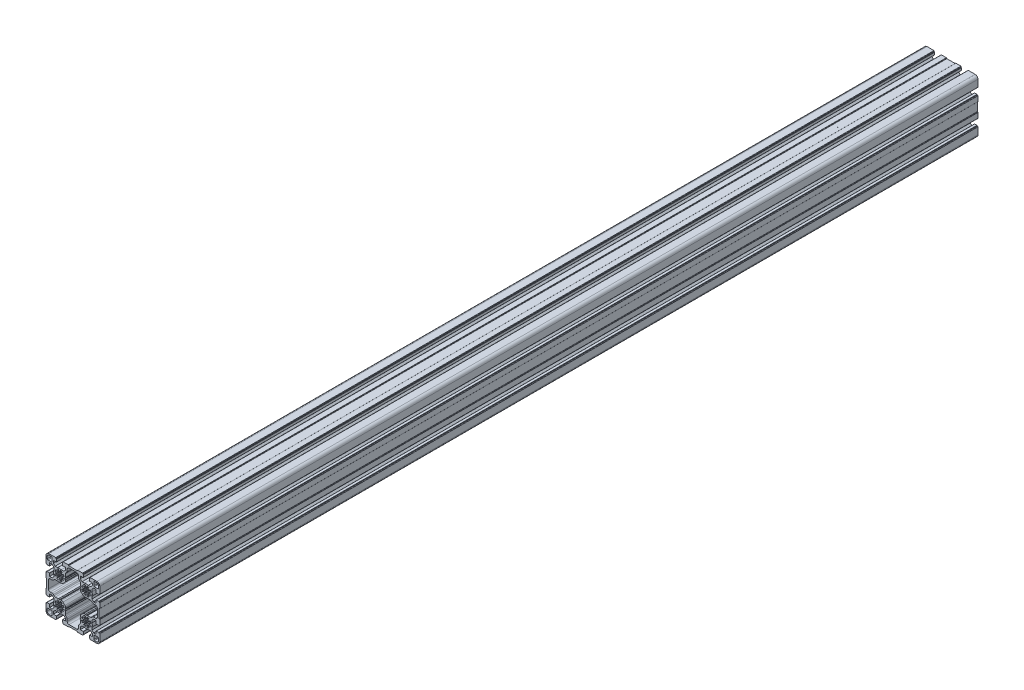
from build123d import *

# Parameters (mm, degrees)
BOSS_EXTRUDE1_DEPTH = 735
SKETCH2_OUTSIDE_W   = 387.1
SKETCH2_OUTSIDE_H   = 387.1
SKETCH2_OUTSIDE_W_2 = 89.98003433
SKETCH2_OUTSIDE_H_2 = 89.980074573
CUT_EXTRUDE1_DEPTH  = 1474.609519808


# Read off the part's stored shape, not the designer's step: Imported1
with BuildPart() as part:
    # Sketch1 → Boss-Extrude1 (new, symmetric)
    with BuildSketch(Plane.XY):
        with BuildLine():
            Line((-36.999936309, 51.000061965), (-36.999936309, 36.999949404))
            ThreePointArc((-36.999936309, 36.999949404), (-37.146382648, 36.646396853), (-37.499935309, 36.499950778))
            ThreePointArc((-37.499935309, 36.499950778), (-37.85348919, 36.353503482), (-37.999934309, 35.999948699))
            Line((-37.999934309, 35.999948699), (-37.999827199, 27.800090876))
            ThreePointArc((-37.999827199, 27.800090876), (-37.853379435, 27.446539596), (-37.499827199, 27.300094141))
            Line((-37.499827199, 27.300094141), (-36.499865902, 27.300094141))
            Line((-36.499865902, 27.300094141), (-36.499865902, 26.800094141))
            ThreePointArc((-36.499865902, 26.800094141), (-36.411997936, 26.587962107), (-36.199865902, 26.500094141))
            Line((-36.199865902, 26.500094141), (-32.299865902, 26.500094141))
            ThreePointArc((-32.299865902, 26.500094141), (-32.087733868, 26.587962107), (-31.999865902, 26.800094141))
            Line((-31.999865902, 26.800094141), (-31.999865902, 31.55021348))
            Line((-31.999865902, 31.55021348), (-27.892690194, 31.55021348))
            Line((-27.892690194, 31.55021348), (-24.999755881, 28.657279167))
            Line((-24.999755881, 28.657279167), (-24.999755881, 24.622983715))
            ThreePointArc((-24.999755881, 24.622983715), (-25.499895222, 21.500060811), (-24.999755881, 18.377137908))
            Line((-24.999755881, 18.377137908), (-24.999755881, 14.342909115))
            Line((-24.999755881, 14.342909115), (-27.892690194, 11.449974802))
            Line((-27.892690194, 11.449974802), (-31.999865902, 11.449974802))
            Line((-31.999865902, 11.449974802), (-31.999865902, 16.200094141))
            ThreePointArc((-31.999865902, 16.200094141), (-32.087733868, 16.412226176), (-32.299865902, 16.500094141))
            Line((-32.299865902, 16.500094141), (-36.199865902, 16.500094141))
            ThreePointArc((-36.199865902, 16.500094141), (-36.411997936, 16.412226176), (-36.499865902, 16.200094141))
            Line((-36.499865902, 16.200094141), (-36.499865902, 15.700094141))
            Line((-36.499865902, 15.700094141), (-37.499974552, 15.700094141))
            ThreePointArc((-37.499974552, 15.700094141), (-37.85352826, 15.553647214), (-37.999974552, 15.200093243))
            Line((-37.999974552, 15.200093243), (-37.999934309, 3.999983871))
            ThreePointArc((-37.999934309, 3.999983871), (-36.535468215, 0.464468094), (-32.999952438, -0.999998))
            Line((-32.999952438, -0.999998), (-21.799856535, -1.000038243))
            ThreePointArc((-21.799856535, -1.000038243), (-21.446302564, -0.853591951), (-21.299855637, -0.500038243))
            Line((-21.299855637, -0.500038243), (-21.299855637, 0.500070407))
            Line((-21.299855637, 0.500070407), (-20.799855637, 0.500070407))
            ThreePointArc((-20.799855637, 0.500070407), (-20.587723602, 0.587938372), (-20.499855637, 0.800070407))
            Line((-20.499855637, 0.800070407), (-20.499855637, 4.700070407))
            ThreePointArc((-20.499855637, 4.700070407), (-20.587723602, 4.912202441), (-20.799855637, 5.000070407))
            Line((-20.799855637, 5.000070407), (-25.549974976, 5.000070407))
            Line((-25.549974976, 5.000070407), (-25.549974976, 9.107246115))
            Line((-25.549974976, 9.107246115), (-22.657040663, 12.000180428))
            Line((-22.657040663, 12.000180428), (-18.62281187, 12.000180428))
            ThreePointArc((-18.62281187, 12.000180428), (-15.499888967, 11.500041087), (-12.376966063, 12.000180428))
            Line((-12.376966063, 12.000180428), (-8.342670611, 12.000180428))
            Line((-8.342670611, 12.000180428), (-5.449736298, 9.107246115))
            Line((-5.449736298, 9.107246115), (-5.449736298, 5.000070407))
            Line((-5.449736298, 5.000070407), (-10.199855637, 5.000070407))
            ThreePointArc((-10.199855637, 5.000070407), (-10.411987671, 4.912202441), (-10.499855637, 4.700070407))
            Line((-10.499855637, 4.700070407), (-10.499855637, 0.800070407))
            ThreePointArc((-10.499855637, 0.800070407), (-10.411987671, 0.587938372), (-10.199855637, 0.500070407))
            Line((-10.199855637, 0.500070407), (-9.699855637, 0.500070407))
            Line((-9.699855637, 0.500070407), (-9.699855637, -0.49989089))
            ThreePointArc((-9.699855637, -0.49989089), (-9.553410182, -0.853443126), (-9.199858902, -0.99989089))
            Line((-9.199858902, -0.99989089), (-1.000001079, -0.999998))
            ThreePointArc((-1.000001079, -0.999998), (-0.646446296, -0.853552881), (-0.499999, -0.499999))
            ThreePointArc((-0.499999, -0.499999), (-0.353552859, -0.146446273), (-1.87e-07, 0))
            Line((-1.87e-07, 0), (14.000112187, 0))
            ThreePointArc((14.000112187, 0), (14.353664859, -0.146446273), (14.500111, -0.499999))
            ThreePointArc((14.500111, -0.499999), (14.646558296, -0.853552881), (15.000113079, -0.999998))
            Line((15.000113079, -0.999998), (23.199970902, -0.99989089))
            ThreePointArc((23.199970902, -0.99989089), (23.553522182, -0.853443126), (23.699967637, -0.49989089))
            Line((23.699967637, -0.49989089), (23.699967637, 0.500070407))
            Line((23.699967637, 0.500070407), (24.199967637, 0.500070407))
            ThreePointArc((24.199967637, 0.500070407), (24.412099671, 0.587938372), (24.499967637, 0.800070407))
            Line((24.499967637, 0.800070407), (24.499967637, 4.700070407))
            ThreePointArc((24.499967637, 4.700070407), (24.412099671, 4.912202441), (24.199967637, 5.000070407))
            Line((24.199967637, 5.000070407), (19.449848298, 5.000070407))
            Line((19.449848298, 5.000070407), (19.449848298, 9.107246115))
            Line((19.449848298, 9.107246115), (22.342782611, 12.000180428))
            Line((22.342782611, 12.000180428), (26.377078063, 12.000180428))
            ThreePointArc((26.377078063, 12.000180428), (29.500000967, 11.500041087), (32.62292387, 12.000180428))
            Line((32.62292387, 12.000180428), (36.657152663, 12.000180428))
            Line((36.657152663, 12.000180428), (39.550086976, 9.107246115))
            Line((39.550086976, 9.107246115), (39.550086976, 5.000070407))
            Line((39.550086976, 5.000070407), (34.799967637, 5.000070407))
            ThreePointArc((34.799967637, 5.000070407), (34.587835602, 4.912202441), (34.499967637, 4.700070407))
            Line((34.499967637, 4.700070407), (34.499967637, 0.800070407))
            ThreePointArc((34.499967637, 0.800070407), (34.587835602, 0.587938372), (34.799967637, 0.500070407))
            Line((34.799967637, 0.500070407), (35.299967637, 0.500070407))
            Line((35.299967637, 0.500070407), (35.299967637, -0.500038243))
            ThreePointArc((35.299967637, -0.500038243), (35.446414564, -0.853591951), (35.799968535, -1.000038243))
            Line((35.799968535, -1.000038243), (47.000077907, -0.999998))
            ThreePointArc((47.000077907, -0.999998), (50.535593684, 0.464468094), (52.000059778, 3.999983871))
            Line((52.000059778, 3.999983871), (52.000100021, 15.200079774))
            ThreePointArc((52.000100021, 15.200079774), (51.85365373, 15.553633745), (51.500100021, 15.700080672))
            Line((51.500100021, 15.700080672), (50.499991371, 15.700080672))
            Line((50.499991371, 15.700080672), (50.499991371, 16.200080672))
            ThreePointArc((50.499991371, 16.200080672), (50.412123406, 16.412212706), (50.199991371, 16.500080672))
            Line((50.199991371, 16.500080672), (46.299991371, 16.500080672))
            ThreePointArc((46.299991371, 16.500080672), (46.087859337, 16.412212706), (45.999991371, 16.200080672))
            Line((45.999991371, 16.200080672), (45.999991371, 11.449961333))
            Line((45.999991371, 11.449961333), (41.892815663, 11.449961333))
            Line((41.892815663, 11.449961333), (38.99988135, 14.342895646))
            Line((38.99988135, 14.342895646), (38.99988135, 18.377124438))
            ThreePointArc((38.99988135, 18.377124438), (39.500020691, 21.500047342), (38.99988135, 24.622970246))
            Line((38.99988135, 24.622970246), (38.99988135, 28.657265698))
            Line((38.99988135, 28.657265698), (41.892815663, 31.550200011))
            Line((41.892815663, 31.550200011), (45.999991371, 31.550200011))
            Line((45.999991371, 31.550200011), (45.999991371, 26.800080672))
            ThreePointArc((45.999991371, 26.800080672), (46.087859337, 26.587948638), (46.299991371, 26.500080672))
            Line((46.299991371, 26.500080672), (50.199991371, 26.500080672))
            ThreePointArc((50.199991371, 26.500080672), (50.412123406, 26.587948638), (50.499991371, 26.800080672))
            Line((50.499991371, 26.800080672), (50.499991371, 27.300080672))
            Line((50.499991371, 27.300080672), (51.499952668, 27.300080672))
            ThreePointArc((51.499952668, 27.300080672), (51.853504904, 27.446526127), (51.999952668, 27.800077406))
            Line((51.999952668, 27.800077406), (52.000059778, 35.999935417))
            ThreePointArc((52.000059778, 35.999935417), (51.853614593, 36.353490079), (51.500060778, 36.499937309))
            ThreePointArc((51.500060778, 36.499937309), (51.146508051, 36.64638345), (51.000061778, 36.999936122))
            Line((51.000061778, 36.999936122), (51.000061778, 51.000048496))
            ThreePointArc((51.000061778, 51.000048496), (51.146508051, 51.353601168), (51.500060778, 51.500047309))
            ThreePointArc((51.500060778, 51.500047309), (51.853614659, 51.646494604), (52.000059778, 52.000049388))
            Line((52.000059778, 52.000049388), (51.999952668, 60.199907211))
            ThreePointArc((51.999952668, 60.199907211), (51.853504904, 60.553458491), (51.499952668, 60.699903946))
            Line((51.499952668, 60.699903946), (50.499991371, 60.699903946))
            Line((50.499991371, 60.699903946), (50.499991371, 61.199903946))
            ThreePointArc((50.499991371, 61.199903946), (50.412123406, 61.41203598), (50.199991371, 61.499903946))
            Line((50.199991371, 61.499903946), (46.299991371, 61.499903946))
            ThreePointArc((46.299991371, 61.499903946), (46.087859337, 61.41203598), (45.999991371, 61.199903946))
            Line((45.999991371, 61.199903946), (45.999991371, 56.449784607))
            Line((45.999991371, 56.449784607), (41.892815663, 56.449784607))
            Line((41.892815663, 56.449784607), (38.99988135, 59.342718919))
            Line((38.99988135, 59.342718919), (38.99988135, 63.377014372))
            ThreePointArc((38.99988135, 63.377014372), (39.500020691, 66.499937276), (38.99988135, 69.622860179))
            Line((38.99988135, 69.622860179), (38.99988135, 73.657088972))
            Line((38.99988135, 73.657088972), (41.892815663, 76.550023284))
            Line((41.892815663, 76.550023284), (45.999991371, 76.550023284))
            Line((45.999991371, 76.550023284), (45.999991371, 71.799903946))
            ThreePointArc((45.999991371, 71.799903946), (46.087859337, 71.587771911), (46.299991371, 71.499903946))
            Line((46.299991371, 71.499903946), (50.199991371, 71.499903946))
            ThreePointArc((50.199991371, 71.499903946), (50.412123406, 71.587771911), (50.499991371, 71.799903946))
            Line((50.499991371, 71.799903946), (50.499991371, 72.299903946))
            Line((50.499991371, 72.299903946), (51.500100021, 72.299903946))
            ThreePointArc((51.500100021, 72.299903946), (51.853653729, 72.446350873), (52.000100021, 72.799904844))
            Line((52.000100021, 72.799904844), (52.000059778, 84.000014216))
            ThreePointArc((52.000059778, 84.000014216), (50.535593684, 87.535529993), (47.000077907, 88.999996087))
            Line((47.000077907, 88.999996087), (35.799982004, 89.00003633))
            ThreePointArc((35.799982004, 89.00003633), (35.446428033, 88.853590038), (35.299981106, 88.50003633))
            Line((35.299981106, 88.50003633), (35.299981106, 87.49992768))
            Line((35.299981106, 87.49992768), (34.799981106, 87.49992768))
            ThreePointArc((34.799981106, 87.49992768), (34.587849072, 87.412059714), (34.499981106, 87.19992768))
            Line((34.499981106, 87.19992768), (34.499981106, 83.29992768))
            ThreePointArc((34.499981106, 83.29992768), (34.587849072, 83.087795646), (34.799981106, 82.99992768))
            Line((34.799981106, 82.99992768), (39.550100445, 82.99992768))
            Line((39.550100445, 82.99992768), (39.550100445, 78.892751972))
            Line((39.550100445, 78.892751972), (36.657166132, 75.999817659))
            Line((36.657166132, 75.999817659), (32.62293734, 75.999817659))
            ThreePointArc((32.62293734, 75.999817659), (29.500014436, 76.499957), (26.377091533, 75.999817659))
            Line((26.377091533, 75.999817659), (22.34279608, 75.999817659))
            Line((22.34279608, 75.999817659), (19.449861767, 78.892751972))
            Line((19.449861767, 78.892751972), (19.449861767, 82.99992768))
            Line((19.449861767, 82.99992768), (24.199981106, 82.99992768))
            ThreePointArc((24.199981106, 82.99992768), (24.41211314, 83.087795646), (24.499981106, 83.29992768))
            Line((24.499981106, 83.29992768), (24.499981106, 87.19992768))
            ThreePointArc((24.499981106, 87.19992768), (24.41211314, 87.412059714), (24.199981106, 87.49992768))
            Line((24.199981106, 87.49992768), (23.699981106, 87.49992768))
            Line((23.699981106, 87.49992768), (23.699981106, 88.499888977))
            ThreePointArc((23.699981106, 88.499888977), (23.553535651, 88.853441213), (23.199984372, 88.999888977))
            Line((23.199984372, 88.999888977), (15.000126548, 88.999996087))
            ThreePointArc((15.000126548, 88.999996087), (14.646571699, 88.853550902), (14.500124469, 88.4999969))
            ThreePointArc((14.500124469, 88.4999969), (14.353678262, 88.146444294), (14.000125656, 87.999998087))
            Line((14.000125656, 87.999998087), (1.3282e-05, 87.999998087))
            ThreePointArc((1.3282e-05, 87.999998087), (-0.35353939, 88.14644436), (-0.499985531, 88.499997087))
            ThreePointArc((-0.499985531, 88.499997087), (-0.646432826, 88.853550968), (-0.99998761, 88.999996087))
            Line((-0.99998761, 88.999996087), (-9.199845433, 88.999888977))
            ThreePointArc((-9.199845433, 88.999888977), (-9.553396713, 88.853441213), (-9.699842167, 88.499888977))
            Line((-9.699842167, 88.499888977), (-9.699842167, 87.49992768))
            Line((-9.699842167, 87.49992768), (-10.199842167, 87.49992768))
            ThreePointArc((-10.199842167, 87.49992768), (-10.411974202, 87.412059714), (-10.499842167, 87.19992768))
            Line((-10.499842167, 87.19992768), (-10.499842167, 83.29992768))
            ThreePointArc((-10.499842167, 83.29992768), (-10.411974202, 83.087795646), (-10.199842167, 82.99992768))
            Line((-10.199842167, 82.99992768), (-5.449722829, 82.99992768))
            Line((-5.449722829, 82.99992768), (-5.449722829, 78.892751972))
            Line((-5.449722829, 78.892751972), (-8.342657141, 75.999817659))
            Line((-8.342657141, 75.999817659), (-12.376952594, 75.999817659))
            ThreePointArc((-12.376952594, 75.999817659), (-15.499875498, 76.499957), (-18.622798401, 75.999817659))
            Line((-18.622798401, 75.999817659), (-22.657027194, 75.999817659))
            Line((-22.657027194, 75.999817659), (-25.549961506, 78.892751972))
            Line((-25.549961506, 78.892751972), (-25.549961506, 82.99992768))
            Line((-25.549961506, 82.99992768), (-20.799842167, 82.99992768))
            ThreePointArc((-20.799842167, 82.99992768), (-20.587710133, 83.087795646), (-20.499842167, 83.29992768))
            Line((-20.499842167, 83.29992768), (-20.499842167, 87.19992768))
            ThreePointArc((-20.499842167, 87.19992768), (-20.587710133, 87.412059714), (-20.799842167, 87.49992768))
            Line((-20.799842167, 87.49992768), (-21.299842167, 87.49992768))
            Line((-21.299842167, 87.49992768), (-21.299842167, 88.50003633))
            ThreePointArc((-21.299842167, 88.50003633), (-21.446289094, 88.853590038), (-21.799843066, 89.00003633))
            Line((-21.799843066, 89.00003633), (-32.999952438, 88.999996087))
            ThreePointArc((-32.999952438, 88.999996087), (-36.535468215, 87.535529993), (-37.999934309, 84.000014216))
            Line((-37.999934309, 84.000014216), (-37.999974552, 72.799918313))
            ThreePointArc((-37.999974552, 72.799918313), (-37.85352826, 72.446364342), (-37.499974552, 72.299917415))
            Line((-37.499974552, 72.299917415), (-36.499865902, 72.299917415))
            Line((-36.499865902, 72.299917415), (-36.499865902, 71.799917415))
            ThreePointArc((-36.499865902, 71.799917415), (-36.411997936, 71.58778538), (-36.199865902, 71.499917415))
            Line((-36.199865902, 71.499917415), (-32.299865902, 71.499917415))
            ThreePointArc((-32.299865902, 71.499917415), (-32.087733868, 71.58778538), (-31.999865902, 71.799917415))
            Line((-31.999865902, 71.799917415), (-31.999865902, 76.550036754))
            Line((-31.999865902, 76.550036754), (-27.892690194, 76.550036754))
            Line((-27.892690194, 76.550036754), (-24.999755881, 73.657102441))
            Line((-24.999755881, 73.657102441), (-24.999755881, 69.622873648))
            ThreePointArc((-24.999755881, 69.622873648), (-25.499895222, 66.499950745), (-24.999755881, 63.377027841))
            Line((-24.999755881, 63.377027841), (-24.999755881, 59.342732389))
            Line((-24.999755881, 59.342732389), (-27.892690194, 56.449798076))
            Line((-27.892690194, 56.449798076), (-31.999865902, 56.449798076))
            Line((-31.999865902, 56.449798076), (-31.999865902, 61.199917415))
            ThreePointArc((-31.999865902, 61.199917415), (-32.087733868, 61.412049449), (-32.299865902, 61.499917415))
            Line((-32.299865902, 61.499917415), (-36.199865902, 61.499917415))
            ThreePointArc((-36.199865902, 61.499917415), (-36.411997936, 61.412049449), (-36.499865902, 61.199917415))
            Line((-36.499865902, 61.199917415), (-36.499865902, 60.699917415))
            Line((-36.499865902, 60.699917415), (-37.499827199, 60.699917415))
            ThreePointArc((-37.499827199, 60.699917415), (-37.853379435, 60.55347196), (-37.999827199, 60.19992068))
            Line((-37.999827199, 60.19992068), (-37.999934309, 52.000062857))
            ThreePointArc((-37.999934309, 52.000062857), (-37.85348919, 51.646508074), (-37.499935309, 51.500060778))
            ThreePointArc((-37.499935309, 51.500060778), (-37.146382582, 51.353614637), (-36.999936309, 51.000061965))
        make_face()
        with BuildLine():
            Line((-14.548768044, 71.893952227), (-14.200413093, 73.869570163))
            ThreePointArc((-14.200413093, 73.869570163), (-13.980977694, 74.201659159), (-13.588551262, 74.268266152))
            ThreePointArc((-13.588551262, 74.268266152), (-12.438411546, 73.890980332), (-11.358358825, 73.344489641))
            ThreePointArc((-11.358358825, 73.344489641), (-11.127969828, 73.019903895), (-11.207628118, 72.629917288))
            Line((-11.207628118, 72.629917288), (-12.35827751, 70.986620792))
            ThreePointArc((-12.35827751, 70.986620792), (-12.444546129, 70.635503719), (-12.271536695, 70.318024257))
            ThreePointArc((-12.271536695, 70.318024257), (-11.964358253, 70.035480556), (-11.681814004, 69.728302619))
            ThreePointArc((-11.681814004, 69.728302619), (-11.364334233, 69.555293751), (-11.013217314, 69.641562997))
            Line((-11.013217314, 69.641562997), (-9.369922872, 70.792215323))
            ThreePointArc((-9.369922872, 70.792215323), (-8.979936408, 70.871874309), (-8.65535025, 70.641485892))
            ThreePointArc((-8.65535025, 70.641485892), (-8.108855325, 69.561428579), (-7.731566878, 68.411283401))
            ThreePointArc((-7.731566878, 68.411283401), (-7.798173762, 68.018856951), (-8.130262697, 67.799421459))
            Line((-8.130262697, 67.799421459), (-10.105880535, 67.451065957))
            ThreePointArc((-10.105880535, 67.451065957), (-10.415158792, 67.263789602), (-10.517314284, 66.916961504))
            ThreePointArc((-10.517314284, 66.916961504), (-10.499894598, 66.49996492), (-10.517312963, 66.082968281))
            ThreePointArc((-10.517312963, 66.082968281), (-10.415156372, 65.736140507), (-10.105877522, 65.548865131))
            Line((-10.105877522, 65.548865131), (-8.130258581, 65.200515888))
            ThreePointArc((-8.130258581, 65.200515888), (-7.79816895, 64.981081448), (-7.731560823, 64.588655209))
            ThreePointArc((-7.731560823, 64.588655209), (-8.10885272, 63.438491711), (-8.655356322, 62.358418075))
            ThreePointArc((-8.655356322, 62.358418075), (-8.979942817, 62.128030134), (-9.369929164, 62.207689691))
            Line((-9.369929164, 62.207689691), (-11.013221919, 63.358344426))
            ThreePointArc((-11.013221919, 63.358344426), (-11.364338711, 63.444614187), (-11.681818737, 63.271605784))
            ThreePointArc((-11.681818737, 63.271605784), (-11.964360479, 62.964431218), (-12.271535905, 62.681890411))
            ThreePointArc((-12.271535905, 62.681890411), (-12.444545274, 62.364410913), (-12.358276582, 62.013293858))
            Line((-12.358276582, 62.013293858), (-11.20762685, 60.369997599))
            ThreePointArc((-11.20762685, 60.369997599), (-11.12796848, 59.98001101), (-11.358357409, 59.655425216))
            ThreePointArc((-11.358357409, 59.655425216), (-12.438411937, 59.108933506), (-13.58855369, 58.73164725))
            ThreePointArc((-13.58855369, 58.73164725), (-13.980980101, 58.798254366), (-14.200415396, 59.130343431))
            Line((-14.200415396, 59.130343431), (-14.54876973, 61.105961476))
            ThreePointArc((-14.54876973, 61.105961476), (-14.736045903, 61.415239843), (-15.08287394, 61.51739554))
            ThreePointArc((-15.08287394, 61.51739554), (-15.499873768, 61.4999761), (-15.916873609, 61.517395252))
            ThreePointArc((-15.916873609, 61.517395252), (-16.263701575, 61.415239315), (-16.450977534, 61.105960818))
            Line((-16.450977534, 61.105960818), (-16.799330501, 59.130342533))
            ThreePointArc((-16.799330501, 59.130342533), (-17.018765567, 58.798253315), (-17.411191932, 58.731645928))
            ThreePointArc((-17.411191932, 58.731645928), (-18.561337179, 59.108932728), (-19.641394839, 59.655425974))
            ThreePointArc((-19.641394839, 59.655425974), (-19.871783709, 59.98001181), (-19.792125267, 60.369998385))
            Line((-19.792125267, 60.369998385), (-18.641475234, 62.013294433))
            ThreePointArc((-18.641475234, 62.013294433), (-18.555206478, 62.364411472), (-18.728215789, 62.681891002))
            ThreePointArc((-18.728215789, 62.681891002), (-19.035396237, 62.964436939), (-19.317942115, 63.271617441))
            ThreePointArc((-19.317942115, 63.271617441), (-19.635421612, 63.444626813), (-19.986538668, 63.358358124))
            Line((-19.986538668, 63.358358124), (-21.629834936, 62.207708407))
            ThreePointArc((-21.629834936, 62.207708407), (-22.019821527, 62.12805004), (-22.344407318, 62.358438972))
            ThreePointArc((-22.344407318, 62.358438972), (-22.890898714, 63.43849277), (-23.268184884, 64.588633717))
            ThreePointArc((-23.268184884, 64.588633717), (-23.201577843, 64.981060141), (-22.869488819, 65.200495499))
            Line((-22.869488819, 65.200495499), (-20.893870841, 65.548850208))
            ThreePointArc((-20.893870841, 65.548850208), (-20.584592509, 65.73612644), (-20.482436878, 66.082954496))
            ThreePointArc((-20.482436878, 66.082954496), (-20.499856398, 66.499957816), (-20.482436742, 66.91696113))
            ThreePointArc((-20.482436742, 66.91696113), (-20.58459226, 67.263789219), (-20.893870531, 67.451065552))
            Line((-20.893870531, 67.451065552), (-22.869488395, 67.799420905))
            ThreePointArc((-22.869488395, 67.799420905), (-23.201577348, 68.018856372), (-23.268184261, 68.411282817))
            ThreePointArc((-23.268184261, 68.411282817), (-22.890897733, 69.561423598), (-22.344406015, 70.641477181))
            ThreePointArc((-22.344406015, 70.641477181), (-22.019820151, 70.871866011), (-21.629833586, 70.792207522))
            Line((-21.629833586, 70.792207522), (-19.98653768, 69.641557287))
            ThreePointArc((-19.98653768, 69.641557287), (-19.635420651, 69.555288488), (-19.317941099, 69.72829776))
            ThreePointArc((-19.317941099, 69.72829776), (-19.035393466, 70.035479832), (-18.728211004, 70.318027043))
            ThreePointArc((-18.728211004, 70.318027043), (-18.555201296, 70.635506357), (-18.641469612, 70.986623504))
            Line((-18.641469612, 70.986623504), (-19.792117586, 72.629920994))
            ThreePointArc((-19.792117586, 72.629920994), (-19.871775539, 73.019907669), (-19.641386262, 73.344493216))
            ThreePointArc((-19.641386262, 73.344493216), (-18.561335104, 73.890982132), (-17.411197305, 74.26826675))
            ThreePointArc((-17.411197305, 74.26826675), (-17.018770894, 74.201659634), (-16.799335599, 73.869570569))
            Line((-16.799335599, 73.869570569), (-16.450981265, 71.893952525))
            ThreePointArc((-16.450981265, 71.893952525), (-16.263705092, 71.584674157), (-15.916877055, 71.48251846))
            ThreePointArc((-15.916877055, 71.48251846), (-15.499874716, 71.4999379), (-15.082872383, 71.48251833))
            ThreePointArc((-15.082872383, 71.48251833), (-14.736044314, 71.584673918), (-14.548768044, 71.893952227))
        make_face(mode=Mode.SUBTRACT)
        with BuildLine():
            Line((-2.499911531, 78.762668768), (-2.499911531, 81.999921211))
            ThreePointArc((-2.499911531, 81.999921211), (-1.621234289, 84.121236849), (0.500081349, 84.999914093))
            Line((0.500081349, 84.999914093), (13.50005759, 84.999914093))
            ThreePointArc((13.50005759, 84.999914093), (15.621373227, 84.12123685), (16.500050469, 81.999921213))
            Line((16.500050469, 81.999921213), (16.500050469, 78.762668774))
            ThreePointArc((16.500050469, 78.762668774), (16.728412272, 77.614618123), (17.378730784, 76.641347737))
            Line((17.378730784, 76.641347737), (18.621364154, 75.398715368))
            ThreePointArc((18.621364154, 75.398715368), (19.271682667, 74.425444982), (19.500044469, 73.277394331))
            Line((19.500044469, 73.277394331), (19.500044469, 68.381600872))
            ThreePointArc((19.500044469, 68.381600872), (19.484820524, 68.305065184), (19.44146641, 68.240181436))
            Line((19.44146641, 68.240181436), (19.309744907, 68.108460933))
            ThreePointArc((19.309744907, 68.108460933), (19.252877958, 67.993147041), (19.277961124, 67.867043995))
            Line((19.277961124, 67.867043995), (19.989102443, 66.635311906))
            ThreePointArc((19.989102443, 66.635311906), (20.029295163, 66.485310697), (19.989102518, 66.335309468))
            Line((19.989102518, 66.335309468), (19.29486804, 65.132858105))
            ThreePointArc((19.29486804, 65.132858105), (19.269784906, 65.006755284), (19.326651604, 64.891441521))
            Line((19.326651604, 64.891441521), (19.441466855, 64.776626271))
            ThreePointArc((19.441466855, 64.776626271), (19.484820541, 64.711743187), (19.500044469, 64.635208301))
            Line((19.500044469, 64.635208301), (19.500044469, 62.742595929))
            ThreePointArc((19.500044469, 62.742595929), (19.728405111, 61.594549926), (20.37872161, 60.621283952))
            Line((20.37872161, 60.621283952), (23.621357758, 57.378647805))
            ThreePointArc((23.621357758, 57.378647805), (24.59462564, 56.728331722), (25.742673027, 56.499971093))
            Line((25.742673027, 56.499971093), (27.635275678, 56.499971093))
            ThreePointArc((27.635275678, 56.499971093), (27.711813662, 56.484747505), (27.776699916, 56.44139321))
            Line((27.776699916, 56.44139321), (27.891504131, 56.326580995))
            ThreePointArc((27.891504131, 56.326580995), (28.006822508, 56.269710455), (28.13293111, 56.294794449))
            Line((28.13293111, 56.294794449), (29.335382844, 56.989029141))
            ThreePointArc((29.335382844, 56.989029141), (29.485384073, 57.029221786), (29.635385282, 56.989029067))
            Line((29.635385282, 56.989029067), (30.867118053, 56.277887353))
            ThreePointArc((30.867118053, 56.277887353), (30.99322638, 56.252803237), (31.108544506, 56.309673727))
            Line((31.108544506, 56.309673727), (31.240252357, 56.441390578))
            ThreePointArc((31.240252357, 56.441390578), (31.305139287, 56.48474686), (31.381678842, 56.499971093))
            Line((31.381678842, 56.499971093), (36.277468121, 56.499971093))
            ThreePointArc((36.277468121, 56.499971093), (37.425512113, 56.27161126), (38.398777623, 55.621297899))
            Line((38.398777623, 55.621297899), (39.641432235, 54.378650287))
            ThreePointArc((39.641432235, 54.378650287), (40.614697745, 53.728336925), (41.762741736, 53.499977093))
            Line((41.762741736, 53.499977093), (44.99999459, 53.499977093))
            ThreePointArc((44.99999459, 53.499977093), (47.121310228, 52.621299849), (47.999987469, 50.49998421))
            Line((47.999987469, 50.49998421), (47.999987469, 37.500006846))
            ThreePointArc((47.999987469, 37.500006846), (47.121309834, 35.378691937), (44.9999946, 34.500015087))
            Line((44.9999946, 34.500015087), (41.762741758, 34.500015087))
            ThreePointArc((41.762741758, 34.500015087), (40.614697766, 34.271655254), (39.641432256, 33.621341893))
            Line((39.641432256, 33.621341893), (38.398777644, 32.378694281))
            ThreePointArc((38.398777644, 32.378694281), (37.425512135, 31.728380919), (36.277468143, 31.500021087))
            Line((36.277468143, 31.500021087), (31.381678863, 31.500021087))
            ThreePointArc((31.381678863, 31.500021087), (31.305139308, 31.515245319), (31.240252379, 31.558601601))
            Line((31.240252379, 31.558601601), (31.108544527, 31.690318452))
            ThreePointArc((31.108544527, 31.690318452), (30.993226401, 31.747188943), (30.867118074, 31.722104826))
            Line((30.867118074, 31.722104826), (29.635385303, 31.010963113))
            ThreePointArc((29.635385303, 31.010963113), (29.485384094, 30.970770393), (29.335382865, 31.010963038))
            Line((29.335382865, 31.010963038), (28.132931131, 31.70519773))
            ThreePointArc((28.132931131, 31.70519773), (28.006822529, 31.730281724), (27.891504152, 31.673411185))
            Line((27.891504152, 31.673411185), (27.776699937, 31.55859897))
            ThreePointArc((27.776699937, 31.55859897), (27.711813683, 31.515244675), (27.635275699, 31.500021087))
            Line((27.635275699, 31.500021087), (25.742674255, 31.500021087))
            ThreePointArc((25.742674255, 31.500021087), (24.594627005, 31.271660096), (23.621359286, 30.621343883))
            Line((23.621359286, 30.621343883), (20.378722992, 27.378711589))
            ThreePointArc((20.378722992, 27.378711589), (19.728405293, 26.405443604), (19.50004449, 25.257395251))
            Line((19.50004449, 25.257395251), (19.50004449, 23.364785399))
            ThreePointArc((19.50004449, 23.364785399), (19.484820407, 23.288249138), (19.441465907, 23.223364939))
            Line((19.441465907, 23.223364939), (19.326652469, 23.108553501))
            ThreePointArc((19.326652469, 23.108553501), (19.269784003, 22.993236611), (19.294867936, 22.867130292))
            Line((19.294867936, 22.867130292), (19.989102475, 21.664680798))
            ThreePointArc((19.989102475, 21.664680798), (20.029294637, 21.514681477), (19.989102401, 21.364682176))
            Line((19.989102401, 21.364682176), (19.277961008, 20.132951961))
            ThreePointArc((19.277961008, 20.132951961), (19.252877037, 20.006845472), (19.309745681, 19.891528477))
            Line((19.309745681, 19.891528477), (19.44146553, 19.759811628))
            ThreePointArc((19.44146553, 19.759811628), (19.484820345, 19.694926927), (19.50004448, 19.618390073))
            Line((19.50004448, 19.618390073), (19.50004448, 14.722599549))
            ThreePointArc((19.50004448, 14.722599549), (19.271683502, 13.574550403), (18.621366402, 12.601281043))
            Line((18.621366402, 12.601281043), (17.378728558, 11.358640199))
            ThreePointArc((17.378728558, 11.358640199), (16.728411831, 10.385371743), (16.50005048, 9.237323649))
            Line((16.50005048, 9.237323649), (16.50005048, 6.000069839))
            ThreePointArc((16.50005048, 6.000069839), (15.621372841, 3.878754927), (13.5000576, 3.000078081))
            Line((13.5000576, 3.000078081), (0.500081359, 3.000078081))
            ThreePointArc((0.500081359, 3.000078081), (-1.621234278, 3.878755323), (-2.49991152, 6.00007096))
            Line((-2.49991152, 6.00007096), (-2.49991152, 9.237321692))
            ThreePointArc((-2.49991152, 9.237321692), (-2.728272498, 10.385370839), (-3.378589598, 11.358640199))
            Line((-3.378589598, 11.358640199), (-4.621227442, 12.601281043))
            ThreePointArc((-4.621227442, 12.601281043), (-5.271544168, 13.574549499), (-5.49990552, 14.722597593))
            Line((-5.49990552, 14.722597593), (-5.49990552, 19.618390073))
            ThreePointArc((-5.49990552, 19.618390073), (-5.484681385, 19.694926927), (-5.44132657, 19.759811628))
            Line((-5.44132657, 19.759811628), (-5.309606722, 19.891528477))
            ThreePointArc((-5.309606722, 19.891528477), (-5.252738078, 20.006845472), (-5.277822049, 20.132951961))
            Line((-5.277822049, 20.132951961), (-5.988963441, 21.364682177))
            ThreePointArc((-5.988963441, 21.364682177), (-6.029155678, 21.514681477), (-5.988963515, 21.664680798))
            Line((-5.988963515, 21.664680798), (-5.294728976, 22.867130292))
            ThreePointArc((-5.294728976, 22.867130292), (-5.269645044, 22.993236611), (-5.326513509, 23.108553501))
            Line((-5.326513509, 23.108553501), (-5.441326947, 23.223364939))
            ThreePointArc((-5.441326947, 23.223364939), (-5.484681443, 23.288249129), (-5.499905531, 23.364785378))
            Line((-5.499905531, 23.364785378), (-5.499905531, 25.257396929))
            ThreePointArc((-5.499905531, 25.257396929), (-5.728266655, 26.40544438), (-6.378584033, 27.378711589))
            Line((-6.378584033, 27.378711589), (-9.621219973, 30.621343529))
            ThreePointArc((-9.621219973, 30.621343529), (-10.594488584, 31.271660104), (-11.742536795, 31.500021087))
            Line((-11.742536795, 31.500021087), (-13.635137489, 31.500021087))
            ThreePointArc((-13.635137489, 31.500021087), (-13.711674019, 31.515245087), (-13.776558547, 31.558599539))
            Line((-13.776558547, 31.558599539), (-13.8913715, 31.673413492))
            ThreePointArc((-13.8913715, 31.673413492), (-14.006687258, 31.730281268), (-14.132792295, 31.705197659))
            Line((-14.132792295, 31.705197659), (-15.335245999, 31.010962984))
            ThreePointArc((-15.335245999, 31.010962984), (-15.485245136, 30.970770929), (-15.635244252, 31.01096306))
            Line((-15.635244252, 31.01096306), (-16.866979083, 31.722104808))
            ThreePointArc((-16.866979083, 31.722104808), (-16.993085993, 31.747188662), (-17.108402955, 31.690319065))
            Line((-17.108402955, 31.690319065), (-17.240113828, 31.558601192))
            ThreePointArc((-17.240113828, 31.558601192), (-17.304999462, 31.515245363), (-17.381537654, 31.500021087))
            Line((-17.381537654, 31.500021087), (-22.277330933, 31.500021087))
            ThreePointArc((-22.277330933, 31.500021087), (-23.425377762, 31.728381485), (-24.398645349, 32.378696945))
            Line((-24.398645349, 32.378696945), (-25.641289632, 33.621339229))
            ThreePointArc((-25.641289632, 33.621339229), (-26.614557219, 34.271654688), (-27.762604048, 34.500015087))
            Line((-27.762604048, 34.500015087), (-30.999855651, 34.500015087))
            ThreePointArc((-30.999855651, 34.500015087), (-33.121171288, 35.378692329), (-33.999848531, 37.500007966))
            Line((-33.999848531, 37.500007966), (-33.999848531, 50.499984207))
            ThreePointArc((-33.999848531, 50.499984207), (-33.121171288, 52.621299844), (-30.999855651, 53.499977087))
            Line((-30.999855651, 53.499977087), (-27.762604048, 53.499977087))
            ThreePointArc((-27.762604048, 53.499977087), (-26.614557219, 53.728337485), (-25.641289632, 54.378652945))
            Line((-25.641289632, 54.378652945), (-24.398645349, 55.621295229))
            ThreePointArc((-24.398645349, 55.621295229), (-23.425377762, 56.271610688), (-22.277330933, 56.499971087))
            Line((-22.277330933, 56.499971087), (-17.381537654, 56.499971087))
            ThreePointArc((-17.381537654, 56.499971087), (-17.304999462, 56.48474681), (-17.240113828, 56.441390982))
            Line((-17.240113828, 56.441390982), (-17.108402955, 56.309673109))
            ThreePointArc((-17.108402955, 56.309673109), (-16.993085993, 56.252803511), (-16.866979082, 56.277887366))
            Line((-16.866979082, 56.277887366), (-15.635244252, 56.989029113))
            ThreePointArc((-15.635244252, 56.989029113), (-15.485245136, 57.029221244), (-15.335245999, 56.989029189))
            Line((-15.335245999, 56.989029189), (-14.132792295, 56.294794514))
            ThreePointArc((-14.132792295, 56.294794514), (-14.006687257, 56.269710906), (-13.8913715, 56.326578681))
            Line((-13.8913715, 56.326578681), (-13.776558547, 56.441392634))
            ThreePointArc((-13.776558547, 56.441392634), (-13.711674019, 56.484747086), (-13.635137489, 56.499971087))
            Line((-13.635137489, 56.499971087), (-11.742535588, 56.499971087))
            ThreePointArc((-11.742535588, 56.499971087), (-10.59448724, 56.728331709), (-9.621218465, 57.378648152))
            Line((-9.621218465, 57.378648152), (-6.378582672, 60.621283946))
            ThreePointArc((-6.378582672, 60.621283946), (-5.728266172, 61.59454992), (-5.499905531, 62.742595923))
            Line((-5.499905531, 62.742595923), (-5.499905531, 64.635208295))
            ThreePointArc((-5.499905531, 64.635208295), (-5.484681602, 64.711743181), (-5.441327917, 64.776626265))
            Line((-5.441327917, 64.776626265), (-5.326512666, 64.891441515))
            ThreePointArc((-5.326512666, 64.891441515), (-5.269645968, 65.006755278), (-5.294729102, 65.132858099))
            Line((-5.294729102, 65.132858099), (-5.988963579, 66.335309462))
            ThreePointArc((-5.988963579, 66.335309462), (-6.029156224, 66.485310691), (-5.988963504, 66.6353119))
            Line((-5.988963504, 66.6353119), (-5.277822185, 67.867043988))
            ThreePointArc((-5.277822185, 67.867043988), (-5.25273902, 67.993147035), (-5.309605968, 68.108460927))
            Line((-5.309605968, 68.108460927), (-5.441327471, 68.24018143))
            ThreePointArc((-5.441327471, 68.24018143), (-5.484681533, 68.305065053), (-5.499905531, 68.381600595))
            Line((-5.499905531, 68.381600595), (-5.499905531, 73.277394325))
            ThreePointArc((-5.499905531, 73.277394325), (-5.271543728, 74.425444976), (-4.621225216, 75.398715362))
            Line((-4.621225216, 75.398715362), (-3.378591846, 76.641347731))
            ThreePointArc((-3.378591846, 76.641347731), (-2.728273333, 77.614618117), (-2.499911531, 78.762668768))
        make_face(mode=Mode.SUBTRACT)
        with BuildLine():
            Line((24.105972248, 67.451021481), (22.130354383, 67.799376834))
            ThreePointArc((22.130354383, 67.799376834), (21.798265431, 68.018812301), (21.731658518, 68.411238746))
            ThreePointArc((21.731658518, 68.411238746), (22.108945046, 69.561379527), (22.655436763, 70.64143311))
            ThreePointArc((22.655436763, 70.64143311), (22.980022627, 70.87182194), (23.370009193, 70.792163451))
            Line((23.370009193, 70.792163451), (25.013305099, 69.641513216))
            ThreePointArc((25.013305099, 69.641513216), (25.364422128, 69.555244417), (25.681901679, 69.728253689))
            ThreePointArc((25.681901679, 69.728253689), (25.964449313, 70.035435761), (26.271631774, 70.317982972))
            ThreePointArc((26.271631774, 70.317982972), (26.444641483, 70.635462286), (26.358373167, 70.986579433))
            Line((26.358373167, 70.986579433), (25.207725193, 72.629876923))
            ThreePointArc((25.207725193, 72.629876923), (25.12806724, 73.019863598), (25.358456517, 73.344449145))
            ThreePointArc((25.358456517, 73.344449145), (26.438507675, 73.890938061), (27.588645474, 74.268222679))
            ThreePointArc((27.588645474, 74.268222679), (27.981071885, 74.201615563), (28.20050718, 73.869526498))
            Line((28.20050718, 73.869526498), (28.548861514, 71.893908454))
            ThreePointArc((28.548861514, 71.893908454), (28.736137687, 71.584630086), (29.082965724, 71.482474389))
            ThreePointArc((29.082965724, 71.482474389), (29.499968063, 71.499893829), (29.916970396, 71.482474259))
            ThreePointArc((29.916970396, 71.482474259), (30.263798465, 71.584629848), (30.451074735, 71.893908157))
            Line((30.451074735, 71.893908157), (30.799429686, 73.869526092))
            ThreePointArc((30.799429686, 73.869526092), (31.018865085, 74.201615089), (31.411291517, 74.268222082))
            ThreePointArc((31.411291517, 74.268222082), (32.561431233, 73.890936261), (33.641483954, 73.34444557))
            ThreePointArc((33.641483954, 73.34444557), (33.87187295, 73.019859824), (33.792214661, 72.629873218))
            Line((33.792214661, 72.629873218), (32.641565269, 70.986576722))
            ThreePointArc((32.641565269, 70.986576722), (32.55529665, 70.635459648), (32.728306084, 70.317980186))
            ThreePointArc((32.728306084, 70.317980186), (33.035484526, 70.035436485), (33.318028774, 69.728258548))
            ThreePointArc((33.318028774, 69.728258548), (33.635508546, 69.55524968), (33.986625465, 69.641518926))
            Line((33.986625465, 69.641518926), (35.629919907, 70.792171252))
            ThreePointArc((35.629919907, 70.792171252), (36.019906371, 70.871830238), (36.344492528, 70.641441821))
            ThreePointArc((36.344492528, 70.641441821), (36.890987454, 69.561384508), (37.268275901, 68.411239331))
            ThreePointArc((37.268275901, 68.411239331), (37.201669017, 68.01881288), (36.869580081, 67.799377389))
            Line((36.869580081, 67.799377389), (34.893962243, 67.451021887))
            ThreePointArc((34.893962243, 67.451021887), (34.584683987, 67.263745531), (34.482528494, 66.916917433))
            ThreePointArc((34.482528494, 66.916917433), (34.499948181, 66.499920849), (34.482529815, 66.08292421))
            ThreePointArc((34.482529815, 66.08292421), (34.584686406, 65.736096436), (34.893965256, 65.54882106))
            Line((34.893965256, 65.54882106), (36.869584198, 65.200471817))
            ThreePointArc((36.869584198, 65.200471817), (37.201673829, 64.981037378), (37.268281956, 64.588611138))
            ThreePointArc((37.268281956, 64.588611138), (36.890990059, 63.43844764), (36.344486457, 62.358374004))
            ThreePointArc((36.344486457, 62.358374004), (36.019899962, 62.127986063), (35.629913615, 62.20764562))
            Line((35.629913615, 62.20764562), (33.98662086, 63.358300355))
            ThreePointArc((33.98662086, 63.358300355), (33.635504067, 63.444570116), (33.318024042, 63.271561714))
            ThreePointArc((33.318024042, 63.271561714), (33.0354823, 62.964387147), (32.728306874, 62.68184634))
            ThreePointArc((32.728306874, 62.68184634), (32.555297505, 62.364366842), (32.641566197, 62.013249787))
            Line((32.641566197, 62.013249787), (33.792215929, 60.369953529))
            ThreePointArc((33.792215929, 60.369953529), (33.871874299, 59.979966939), (33.64148537, 59.655381145))
            ThreePointArc((33.64148537, 59.655381145), (32.561430842, 59.108889435), (31.411289089, 58.731603179))
            ThreePointArc((31.411289089, 58.731603179), (31.018862677, 58.798210295), (30.799427382, 59.130299361))
            Line((30.799427382, 59.130299361), (30.451073049, 61.105917405))
            ThreePointArc((30.451073049, 61.105917405), (30.263796876, 61.415195772), (29.916968839, 61.517351469))
            ThreePointArc((29.916968839, 61.517351469), (29.49996901, 61.499932029), (29.08296917, 61.517351181))
            ThreePointArc((29.08296917, 61.517351181), (28.736141204, 61.415195244), (28.548865244, 61.105916747))
            Line((28.548865244, 61.105916747), (28.200512277, 59.130298462))
            ThreePointArc((28.200512277, 59.130298462), (27.981077212, 58.798209245), (27.588650847, 58.731601858))
            ThreePointArc((27.588650847, 58.731601858), (26.4385056, 59.108888657), (25.358447939, 59.655381904))
            ThreePointArc((25.358447939, 59.655381904), (25.12805907, 59.979967739), (25.207717511, 60.369954314))
            Line((25.207717511, 60.369954314), (26.358367544, 62.013250362))
            ThreePointArc((26.358367544, 62.013250362), (26.4446363, 62.364367401), (26.27162699, 62.681846932))
            ThreePointArc((26.27162699, 62.681846932), (25.964446542, 62.964392868), (25.681900664, 63.271573371))
            ThreePointArc((25.681900664, 63.271573371), (25.364421167, 63.444582742), (25.013304111, 63.358314053))
            Line((25.013304111, 63.358314053), (23.370007843, 62.207664336))
            ThreePointArc((23.370007843, 62.207664336), (22.980021252, 62.128005969), (22.655435461, 62.358394901))
            ThreePointArc((22.655435461, 62.358394901), (22.108944065, 63.438448699), (21.731657895, 64.588589646))
            ThreePointArc((21.731657895, 64.588589646), (21.798264936, 64.98101607), (22.130353959, 65.200451428))
            Line((22.130353959, 65.200451428), (24.105971937, 65.548806137))
            ThreePointArc((24.105971937, 65.548806137), (24.415250269, 65.736082369), (24.517405901, 66.082910425))
            ThreePointArc((24.517405901, 66.082910425), (24.499986381, 66.499913745), (24.517406037, 66.916917059))
            ThreePointArc((24.517406037, 66.916917059), (24.415250518, 67.263745148), (24.105972248, 67.451021481))
        make_face(mode=Mode.SUBTRACT)
        with BuildLine():
            Line((41.999999469, 2.000079713), (41.999999469, 8.00006846))
            ThreePointArc((41.999999469, 8.00006846), (42.292891883, 8.707173672), (42.999997096, 9.000066087))
            Line((42.999997096, 9.000066087), (48.999985843, 9.000066087))
            ThreePointArc((48.999985843, 9.000066087), (49.707091055, 8.707173672), (49.999983469, 8.00006846))
            Line((49.999983469, 8.00006846), (49.999983469, 4.000073846))
            ThreePointArc((49.999983469, 4.000073846), (49.12130583, 1.878758933), (46.99999059, 1.000082087))
            Line((46.99999059, 1.000082087), (42.999997096, 1.000082087))
            ThreePointArc((42.999997096, 1.000082087), (42.292891883, 1.292974501), (41.999999469, 2.000079713))
        make_face(mode=Mode.SUBTRACT)
        with BuildLine():
            Line((26.358406852, 25.986707591), (25.207758879, 27.63000508))
            ThreePointArc((25.207758879, 27.63000508), (25.128100926, 28.019991755), (25.358490202, 28.344577302))
            ThreePointArc((25.358490202, 28.344577302), (26.43854136, 28.891066218), (27.588679159, 29.268350836))
            ThreePointArc((27.588679159, 29.268350836), (27.981105571, 29.201743721), (28.200540866, 28.869654655))
            Line((28.200540866, 28.869654655), (28.548895199, 26.894036611))
            ThreePointArc((28.548895199, 26.894036611), (28.736171372, 26.584758244), (29.082999409, 26.482602547))
            ThreePointArc((29.082999409, 26.482602547), (29.500001748, 26.500021987), (29.917004082, 26.482602416))
            ThreePointArc((29.917004082, 26.482602416), (30.263832151, 26.584758005), (30.45110842, 26.894036314))
            Line((30.45110842, 26.894036314), (30.799463371, 28.869654249))
            ThreePointArc((30.799463371, 28.869654249), (31.01889877, 29.201743246), (31.411325202, 29.268350239))
            ThreePointArc((31.411325202, 29.268350239), (32.561464918, 28.891064419), (33.64151764, 28.344573727))
            ThreePointArc((33.64151764, 28.344573727), (33.871906636, 28.019987981), (33.792248346, 27.630001375))
            Line((33.792248346, 27.630001375), (32.641598954, 25.986704879))
            ThreePointArc((32.641598954, 25.986704879), (32.555330335, 25.635587806), (32.72833977, 25.318108343))
            ThreePointArc((32.72833977, 25.318108343), (33.035518211, 25.035564643), (33.31806246, 24.728386706))
            ThreePointArc((33.31806246, 24.728386706), (33.635542232, 24.555377838), (33.986659151, 24.641647084))
            Line((33.986659151, 24.641647084), (35.629953593, 25.79229941))
            ThreePointArc((35.629953593, 25.79229941), (36.019940057, 25.871958395), (36.344526214, 25.641569979))
            ThreePointArc((36.344526214, 25.641569979), (36.891021139, 24.561512666), (37.268309586, 23.411367488))
            ThreePointArc((37.268309586, 23.411367488), (37.201702703, 23.018941037), (36.869613767, 22.799505546))
            Line((36.869613767, 22.799505546), (34.893995929, 22.451150044))
            ThreePointArc((34.893995929, 22.451150044), (34.584717672, 22.263873688), (34.48256218, 21.917045591))
            ThreePointArc((34.48256218, 21.917045591), (34.499981867, 21.500049007), (34.482563501, 21.083052367))
            ThreePointArc((34.482563501, 21.083052367), (34.584720092, 20.736224594), (34.893998942, 20.548949218))
            Line((34.893998942, 20.548949218), (36.869617884, 20.200599974))
            ThreePointArc((36.869617884, 20.200599974), (37.201707514, 19.981165535), (37.268315641, 19.588739296))
            ThreePointArc((37.268315641, 19.588739296), (36.891023745, 18.438575798), (36.344520143, 17.358502162))
            ThreePointArc((36.344520143, 17.358502162), (36.019933648, 17.128114221), (35.629947301, 17.207773778))
            Line((35.629947301, 17.207773778), (33.986654545, 18.358428513))
            ThreePointArc((33.986654545, 18.358428513), (33.635537753, 18.444698273), (33.318057728, 18.271689871))
            ThreePointArc((33.318057728, 18.271689871), (33.035515985, 17.964515305), (32.728340559, 17.681974498))
            ThreePointArc((32.728340559, 17.681974498), (32.555331191, 17.364494999), (32.641599882, 17.013377944))
            Line((32.641599882, 17.013377944), (33.792249614, 15.370081686))
            ThreePointArc((33.792249614, 15.370081686), (33.871907984, 14.980095096), (33.641519055, 14.655509303))
            ThreePointArc((33.641519055, 14.655509303), (32.561464528, 14.109017593), (31.411322774, 13.731731337))
            ThreePointArc((31.411322774, 13.731731337), (31.018896363, 13.798338453), (30.799461068, 14.130427518))
            Line((30.799461068, 14.130427518), (30.451106734, 16.106045562))
            ThreePointArc((30.451106734, 16.106045562), (30.263830561, 16.41532393), (29.917002524, 16.517479627))
            ThreePointArc((29.917002524, 16.517479627), (29.500002696, 16.500060187), (29.083002855, 16.517479338))
            ThreePointArc((29.083002855, 16.517479338), (28.736174889, 16.415323401), (28.54889893, 16.106044904))
            Line((28.54889893, 16.106044904), (28.200545963, 14.130426619))
            ThreePointArc((28.200545963, 14.130426619), (27.981110898, 13.798337402), (27.588684532, 13.731730015))
            ThreePointArc((27.588684532, 13.731730015), (26.438539285, 14.109016814), (25.358481625, 14.655510061))
            ThreePointArc((25.358481625, 14.655510061), (25.128092755, 14.980095897), (25.207751197, 15.370082472))
            Line((25.207751197, 15.370082472), (26.35840123, 17.013378519))
            ThreePointArc((26.35840123, 17.013378519), (26.444669986, 17.364495559), (26.271660675, 17.681975089))
            ThreePointArc((26.271660675, 17.681975089), (25.964480227, 17.964521026), (25.681934349, 18.271701528))
            ThreePointArc((25.681934349, 18.271701528), (25.364454852, 18.444710899), (25.013337797, 18.358442211))
            Line((25.013337797, 18.358442211), (23.370041528, 17.207792493))
            ThreePointArc((23.370041528, 17.207792493), (22.980054938, 17.128134127), (22.655469146, 17.358523059))
            ThreePointArc((22.655469146, 17.358523059), (22.10897775, 18.438576857), (21.73169158, 19.588717803))
            ThreePointArc((21.73169158, 19.588717803), (21.798298621, 19.981144227), (22.130387645, 20.200579585))
            Line((22.130387645, 20.200579585), (24.106005623, 20.548934294))
            ThreePointArc((24.106005623, 20.548934294), (24.415283955, 20.736210526), (24.517439586, 21.083038582))
            ThreePointArc((24.517439586, 21.083038582), (24.500020067, 21.500041902), (24.517439722, 21.917045216))
            ThreePointArc((24.517439722, 21.917045216), (24.415284204, 22.263873306), (24.106005933, 22.451149639))
            Line((24.106005933, 22.451149639), (22.130388069, 22.799504992))
            ThreePointArc((22.130388069, 22.799504992), (21.798299117, 23.018940458), (21.731692204, 23.411366904))
            ThreePointArc((21.731692204, 23.411366904), (22.108978731, 24.561507685), (22.655470449, 25.641561268))
            ThreePointArc((22.655470449, 25.641561268), (22.980056313, 25.871950098), (23.370042878, 25.792291608))
            Line((23.370042878, 25.792291608), (25.013338785, 24.641641374))
            ThreePointArc((25.013338785, 24.641641374), (25.364455813, 24.555372575), (25.681935365, 24.728381846))
            ThreePointArc((25.681935365, 24.728381846), (25.964482999, 25.035563919), (26.27166546, 25.31811113))
            ThreePointArc((26.27166546, 25.31811113), (26.444675168, 25.635590443), (26.358406852, 25.986707591))
        make_face(mode=Mode.SUBTRACT)
        with BuildLine():
            Line((-10.105893492, 20.548909366), (-8.13027455, 20.200560122))
            ThreePointArc((-8.13027455, 20.200560122), (-7.798184919, 19.981125683), (-7.731576792, 19.588699443))
            ThreePointArc((-7.731576792, 19.588699443), (-8.108868689, 18.438535946), (-8.655372291, 17.35846231))
            ThreePointArc((-8.655372291, 17.35846231), (-8.979958786, 17.128074369), (-9.369945133, 17.207733926))
            Line((-9.369945133, 17.207733926), (-11.013237888, 18.358388661))
            ThreePointArc((-11.013237888, 18.358388661), (-11.364354681, 18.444658421), (-11.681834706, 18.271650019))
            ThreePointArc((-11.681834706, 18.271650019), (-11.964376448, 17.964475453), (-12.271551874, 17.681934646))
            ThreePointArc((-12.271551874, 17.681934646), (-12.444561243, 17.364455147), (-12.358292551, 17.013338092))
            Line((-12.358292551, 17.013338092), (-11.207642819, 15.370041834))
            ThreePointArc((-11.207642819, 15.370041834), (-11.127984449, 14.980055244), (-11.358373378, 14.655469451))
            ThreePointArc((-11.358373378, 14.655469451), (-12.438427906, 14.108977741), (-13.58856966, 13.731691485))
            ThreePointArc((-13.58856966, 13.731691485), (-13.980996071, 13.798298601), (-14.200431366, 14.130387666))
            Line((-14.200431366, 14.130387666), (-14.548785699, 16.10600571))
            ThreePointArc((-14.548785699, 16.10600571), (-14.736061872, 16.415284078), (-15.082889909, 16.517439775))
            ThreePointArc((-15.082889909, 16.517439775), (-15.499889738, 16.500020335), (-15.916889578, 16.517439486))
            ThreePointArc((-15.916889578, 16.517439486), (-16.263717545, 16.415283549), (-16.450993504, 16.106005052))
            Line((-16.450993504, 16.106005052), (-16.799346471, 14.130386767))
            ThreePointArc((-16.799346471, 14.130386767), (-17.018781536, 13.79829755), (-17.411207901, 13.731690163))
            ThreePointArc((-17.411207901, 13.731690163), (-18.561353148, 14.108976962), (-19.641410809, 14.655470209))
            ThreePointArc((-19.641410809, 14.655470209), (-19.871799678, 14.980056045), (-19.792141237, 15.37004262))
            Line((-19.792141237, 15.37004262), (-18.641491204, 17.013338667))
            ThreePointArc((-18.641491204, 17.013338667), (-18.555222448, 17.364455707), (-18.728231758, 17.681935237))
            ThreePointArc((-18.728231758, 17.681935237), (-19.035412206, 17.964481174), (-19.317958084, 18.271661676))
            ThreePointArc((-19.317958084, 18.271661676), (-19.635437581, 18.444671047), (-19.986554637, 18.358402359))
            Line((-19.986554637, 18.358402359), (-21.629850905, 17.207752641))
            ThreePointArc((-21.629850905, 17.207752641), (-22.019837496, 17.128094275), (-22.344423287, 17.358483207))
            ThreePointArc((-22.344423287, 17.358483207), (-22.890914683, 18.438537005), (-23.268200854, 19.588677951))
            ThreePointArc((-23.268200854, 19.588677951), (-23.201593812, 19.981104375), (-22.869504789, 20.200539733))
            Line((-22.869504789, 20.200539733), (-20.893886811, 20.548894442))
            ThreePointArc((-20.893886811, 20.548894442), (-20.584608479, 20.736170674), (-20.482452848, 21.08299873))
            ThreePointArc((-20.482452848, 21.08299873), (-20.499872367, 21.50000205), (-20.482452712, 21.917005364))
            ThreePointArc((-20.482452712, 21.917005364), (-20.58460823, 22.263833454), (-20.893886501, 22.451109787))
            Line((-20.893886501, 22.451109787), (-22.869504365, 22.79946514))
            ThreePointArc((-22.869504365, 22.79946514), (-23.201593317, 23.018900606), (-23.26820023, 23.411327052))
            ThreePointArc((-23.26820023, 23.411327052), (-22.890913703, 24.561467833), (-22.344421985, 25.641521416))
            ThreePointArc((-22.344421985, 25.641521416), (-22.019836121, 25.871910246), (-21.629849555, 25.792251756))
            Line((-21.629849555, 25.792251756), (-19.986553649, 24.641601522))
            ThreePointArc((-19.986553649, 24.641601522), (-19.63543662, 24.555332723), (-19.317957069, 24.728341994))
            ThreePointArc((-19.317957069, 24.728341994), (-19.035409435, 25.035524067), (-18.728226974, 25.318071278))
            ThreePointArc((-18.728226974, 25.318071278), (-18.555217265, 25.635550591), (-18.641485582, 25.986667739))
            Line((-18.641485582, 25.986667739), (-19.792133555, 27.629965228))
            ThreePointArc((-19.792133555, 27.629965228), (-19.871791508, 28.019951903), (-19.641402232, 28.34453745))
            ThreePointArc((-19.641402232, 28.34453745), (-18.561351073, 28.891026366), (-17.411213274, 29.268310984))
            ThreePointArc((-17.411213274, 29.268310984), (-17.018786863, 29.201703869), (-16.799351568, 28.869614803))
            Line((-16.799351568, 28.869614803), (-16.450997234, 26.893996759))
            ThreePointArc((-16.450997234, 26.893996759), (-16.263721061, 26.584718392), (-15.916893025, 26.482562695))
            ThreePointArc((-15.916893025, 26.482562695), (-15.499890685, 26.499982135), (-15.082888352, 26.482562564))
            ThreePointArc((-15.082888352, 26.482562564), (-14.736060283, 26.584718153), (-14.548784013, 26.893996462))
            Line((-14.548784013, 26.893996462), (-14.200429062, 28.869614397))
            ThreePointArc((-14.200429062, 28.869614397), (-13.980993663, 29.201703394), (-13.588567231, 29.268310387))
            ThreePointArc((-13.588567231, 29.268310387), (-12.438427515, 28.891024567), (-11.358374794, 28.344533875))
            ThreePointArc((-11.358374794, 28.344533875), (-11.127985798, 28.019948129), (-11.207644087, 27.629961523))
            Line((-11.207644087, 27.629961523), (-12.358293479, 25.986665027))
            ThreePointArc((-12.358293479, 25.986665027), (-12.444562099, 25.635547954), (-12.271552664, 25.318068491))
            ThreePointArc((-12.271552664, 25.318068491), (-11.964374223, 25.035524791), (-11.681829974, 24.728346853))
            ThreePointArc((-11.681829974, 24.728346853), (-11.364350202, 24.555337986), (-11.013233283, 24.641607232))
            Line((-11.013233283, 24.641607232), (-9.369938841, 25.792259558))
            ThreePointArc((-9.369938841, 25.792259558), (-8.979952377, 25.871918543), (-8.65536622, 25.641530127))
            ThreePointArc((-8.65536622, 25.641530127), (-8.108871294, 24.561472814), (-7.731582847, 23.411327636))
            ThreePointArc((-7.731582847, 23.411327636), (-7.798189731, 23.018901185), (-8.130278667, 22.799465694))
            Line((-8.130278667, 22.799465694), (-10.105896505, 22.451110192))
            ThreePointArc((-10.105896505, 22.451110192), (-10.415174762, 22.263833836), (-10.517330254, 21.917005739))
            ThreePointArc((-10.517330254, 21.917005739), (-10.499910567, 21.500009155), (-10.517328933, 21.083012515))
            ThreePointArc((-10.517328933, 21.083012515), (-10.415172342, 20.736184742), (-10.105893492, 20.548909366))
        make_face(mode=Mode.SUBTRACT)
        with BuildLine():
            Line((-27.999860531, 8.00006846), (-27.999860531, 2.00007934))
            ThreePointArc((-27.999860531, 2.00007934), (-28.292753077, 1.292974369), (-28.999858157, 1.000082087))
            Line((-28.999858157, 1.000082087), (-32.999851652, 1.000082087))
            ThreePointArc((-32.999851652, 1.000082087), (-35.121167288, 1.878759329), (-35.999844531, 4.000074966))
            Line((-35.999844531, 4.000074966), (-35.999844531, 8.00006846))
            ThreePointArc((-35.999844531, 8.00006846), (-35.706952117, 8.707173673), (-34.999846904, 9.000066087))
            Line((-34.999846904, 9.000066087), (-28.999858157, 9.000066087))
            ThreePointArc((-28.999858157, 9.000066087), (-28.292752945, 8.707173673), (-27.999860531, 8.00006846))
        make_face(mode=Mode.SUBTRACT)
        with BuildLine():
            Line((41.999999469, 79.999923713), (41.999999469, 85.99991246))
            ThreePointArc((41.999999469, 85.99991246), (42.292891883, 86.707017672), (42.999997096, 86.999910087))
            Line((42.999997096, 86.999910087), (46.99999059, 86.999910087))
            ThreePointArc((46.99999059, 86.999910087), (49.121306227, 86.121232844), (49.999983469, 83.999917207))
            Line((49.999983469, 83.999917207), (49.999983469, 79.99992334))
            ThreePointArc((49.999983469, 79.99992334), (49.707090923, 79.292818369), (48.999985843, 78.999926087))
            Line((48.999985843, 78.999926087), (42.999997096, 78.999926087))
            ThreePointArc((42.999997096, 78.999926087), (42.292891883, 79.292818501), (41.999999469, 79.999923713))
        make_face(mode=Mode.SUBTRACT)
        with BuildLine():
            Line((-35.999844531, 79.999923713), (-35.999844531, 83.999917207))
            ThreePointArc((-35.999844531, 83.999917207), (-35.121167288, 86.121232844), (-32.999851651, 86.999910087))
            Line((-32.999851651, 86.999910087), (-28.999858157, 86.999910087))
            ThreePointArc((-28.999858157, 86.999910087), (-28.292752945, 86.707017673), (-27.999860531, 85.99991246))
            Line((-27.999860531, 85.99991246), (-27.999860531, 79.99992334))
            ThreePointArc((-27.999860531, 79.99992334), (-28.292753077, 79.292818369), (-28.999858157, 78.999926087))
            Line((-28.999858157, 78.999926087), (-34.999846904, 78.999926087))
            ThreePointArc((-34.999846904, 78.999926087), (-35.706952117, 79.292818501), (-35.999844531, 79.999923713))
        make_face(mode=Mode.SUBTRACT)
    extrude(amount=BOSS_EXTRUDE1_DEPTH, both=True)

    # Sketch2 outside → Cut-Extrude1 (cut, through all)
    with BuildSketch(Plane(origin=(0, 0, -735), x_dir=(-1, 0, 0), z_dir=(0, 0, -1))):
        with Locations((-7, 44)):
            Rectangle(SKETCH2_OUTSIDE_W, SKETCH2_OUTSIDE_H)
        with Locations((-7.000082856, 43.999999044)):
            Rectangle(SKETCH2_OUTSIDE_W_2, SKETCH2_OUTSIDE_H_2, mode=Mode.SUBTRACT)
    extrude(amount=-CUT_EXTRUDE1_DEPTH, mode=Mode.SUBTRACT)


solid = part.part
